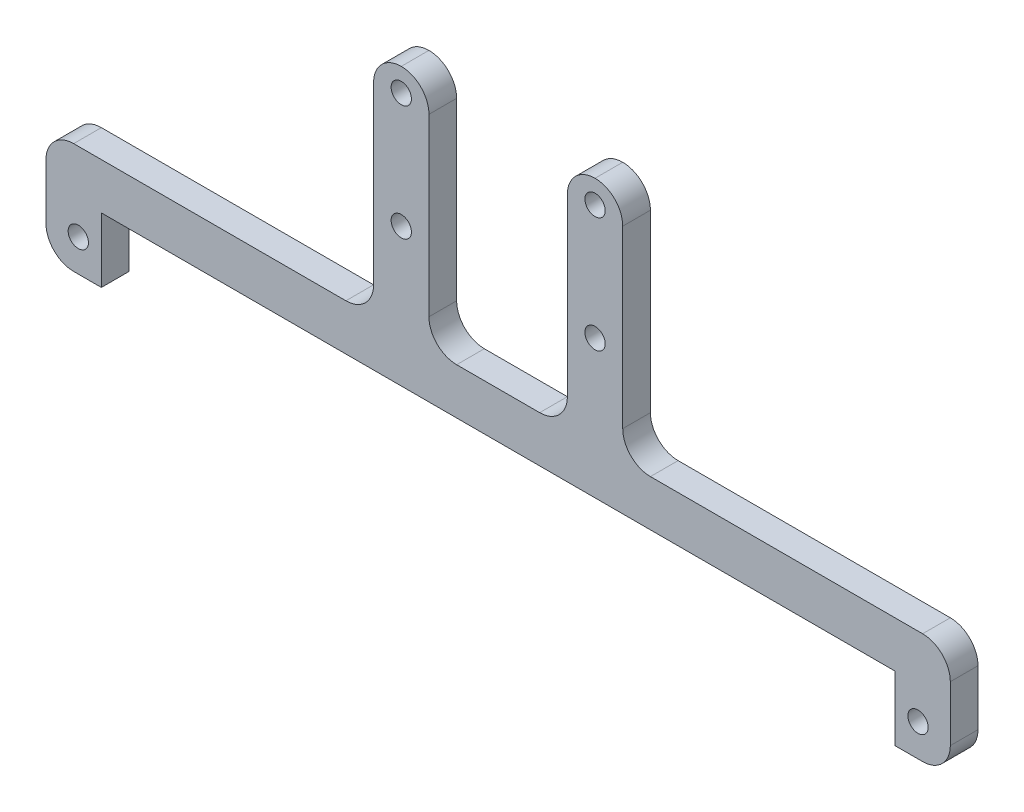
from build123d import *

# Parameters (mm, degrees)
BOSS_EXTRU_1_DEPTH      = 3
ESQUISSE2_R             = 1.1
ENL_V_MAT_EXTRU_1_DEPTH = 3
ESQUISSE3_R             = 1.1
ENL_V_MAT_EXTRU_2_DEPTH = 3
CONG_1_R                = 3
CONG_1_OF_SYM_TRIE1_R   = 3


with BuildPart() as part:
    # Esquisse1 → Boss.-Extru.1 (new body)
    with BuildSketch(Plane.XY):
        Polygon((-13.5, 5), (-49, 5), (-49, 0), (-49, -7), (-43, -7), (-43, 0), (0, 0), (0, 5), (-7.5, 5), (-7.5, 30), (-13.5, 30), align=None)
    boss_extru_1 = extrude(amount=BOSS_EXTRU_1_DEPTH)

    # Esquisse2 → Enlèv. mat.-Extru.1 (cut)
    with BuildSketch(Plane.XY.offset(3)):
        with Locations((-45.5, -3.5)):
            Circle(ESQUISSE2_R)
    enl_v_mat_extru_1 = extrude(amount=-ENL_V_MAT_EXTRU_1_DEPTH, mode=Mode.SUBTRACT)

    # Esquisse3 → Enlèv. mat.-Extru.2 (cut)
    with BuildSketch(Plane.XY.offset(3)):
        with Locations((-10.5, 15)):
            Circle(ESQUISSE3_R)
        with Locations((-10.5, 27.5)):
            Circle(ESQUISSE3_R)
    enl_v_mat_extru_2 = extrude(amount=-ENL_V_MAT_EXTRU_2_DEPTH, mode=Mode.SUBTRACT)

    # Congé1
    cong_1_edges = [part.edges().sort_by_distance(p)[0] for p in [
        (-13.5, 5, 1.5),
        (-7.5, 5, 1.5),
        (-7.5, 30, 1.5),
        (-13.5, 30, 1.5),
        (-49, 5, 1.5),
        (-49, -7, 1.5),
    ]]
    fillet(cong_1_edges, radius=CONG_1_R - 0.0001)  # a hair under: the kernel refuses the full size

    # Symétrie1: Boss.-Extru.1, Enlèv. mat.-Extru.1, Enlèv. mat.-Extru.2 across plane
    add(boss_extru_1.mirror(Plane(origin=(0, 0, 0), x_dir=(0, 0, 1), z_dir=(1, 0, 0))))
    add(enl_v_mat_extru_1.mirror(Plane(origin=(0, 0, 0), x_dir=(0, 0, 1), z_dir=(1, 0, 0))), mode=Mode.SUBTRACT)
    add(enl_v_mat_extru_2.mirror(Plane(origin=(0, 0, 0), x_dir=(0, 0, 1), z_dir=(1, 0, 0))), mode=Mode.SUBTRACT)

    # Congé1 of Symétrie1
    cong_1_of_sym_trie1_edges = [part.edges().sort_by_distance(p)[0] for p in [
        (13.5, 5, 1.5),
        (7.5, 5, 1.5),
        (7.5, 30, 1.5),
        (13.5, 30, 1.5),
        (49, 5, 1.5),
        (49, -7, 1.5),
    ]]
    fillet(cong_1_of_sym_trie1_edges, radius=CONG_1_OF_SYM_TRIE1_R - 0.0001)  # a hair under: the kernel refuses the full size


solid = part.part
